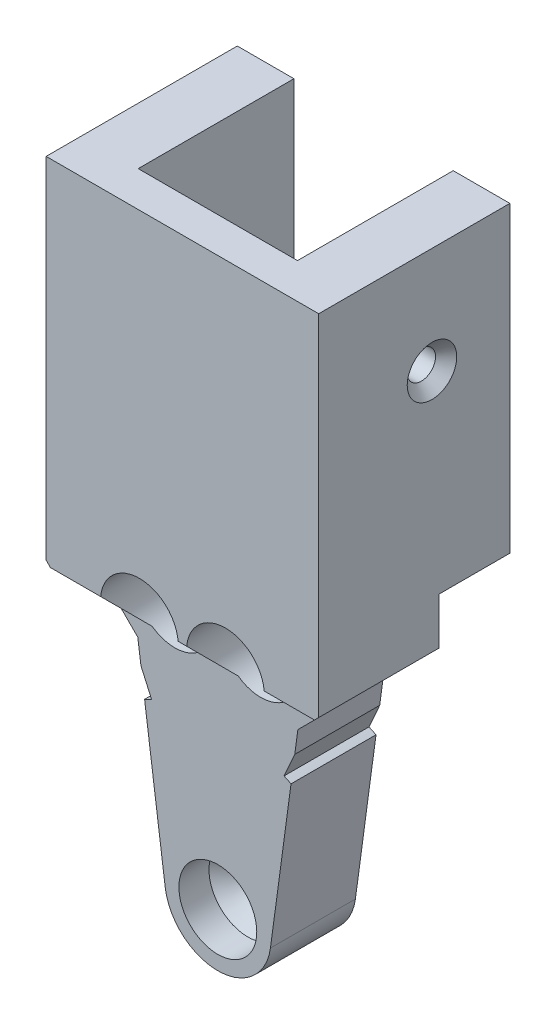
from build123d import *

# Parameters (mm, degrees)
SKETCH1_R                = 2.75
BOSS_EXTRUDE1_DEPTH      = 12
BOSS_EXTRUDE2_DEPTH      = 30
BOSS_EXTRUDE2_DEPTH_BACK = 10
CHAMFER1_SIZE            = 17.501152045
CHAMFER1_SIZE_2          = 15
SKETCH4_R                = 2
CUT_EXTRUDE1_DEPTH       = 30
CHAMFER2_SIZE            = 1.5
CUT_EXTRUDE2_DEPTH       = 30
CUT_EXTRUDE2_DEPTH_BACK  = 4
SKETCH5_R                = 5.5
CHAMFER3_SIZE            = 3
BOSS_EXTRUDE3_DEPTH      = 10


with BuildPart() as part:
    # Sketch1 → Boss-Extrude1 (new body)
    with BuildSketch(Plane.XY):
        with BuildLine():
            Line((0, 55), (-15, 55))
            Line((-15, 55), (-10.865898, 24.40520649))
            Line((-10.865898, 24.40520649), (-9.354942791, 21.011545526))
            ThreePointArc((-9.354942791, 21.011545526), (-9.852249787, 20.783002048), (-10.343977944, 20.542690191))
            Line((-10.343977944, 20.542690191), (-7.432453853, -1.004305596))
            ThreePointArc((-7.432453853, -1.004305596), (-4.935468976, -5.647224627), (0, -7.5))
            Line((0, -7.5), (0, -2.75))
            ThreePointArc((0, -2.75), (-2.75, 0), (0, 2.75))
            Line((0, 2.75), (0, 55))
        make_face()
        with Locations((-6.077686218, 34.468271355)):
            Circle(SKETCH1_R, mode=Mode.SUBTRACT)
    extrude(amount=BOSS_EXTRUDE1_DEPTH)

    # Sketch3 → Boss-Extrude2 (add, two sides: drawn at the far end of the back side and taken through both)
    with BuildSketch(Plane(origin=(0, 55, 0), x_dir=(1, 0, 0), z_dir=(0, 1, 0)).offset(-BOSS_EXTRUDE2_DEPTH_BACK)):
        Polygon((0, -17), (-19.25, -17), (-19.25, 10), (-11.25, 10), (-11.25, -12), (0, -12), align=None)
    extrude(amount=BOSS_EXTRUDE2_DEPTH + BOSS_EXTRUDE2_DEPTH_BACK)

    # Chamfer1
    # the kernel refuses this chamfer: 17.501152045, 15 mm, written as the material it adds along each edge
    with BuildSketch(Plane(origin=(-13.648756365, 45, 12), x_dir=(0.1571469904838525, -0.9875752241636421, 0), z_dir=(0, 0, -1))) as chamfer1_piece_1_section:
        Polygon((CHAMFER1_SIZE * 0.999724117502, CHAMFER1_SIZE * 0.0234880574124), (-CHAMFER1_SIZE_2 * 0.157146990484, CHAMFER1_SIZE_2 * 0.987575224164), (0, 0), align=None)
    chamfer1_piece_1 = extrude(amount=12, mode=Mode.PRIVATE)
    chamfer1_piece_1 = split(chamfer1_piece_1, bisect_by=Plane(origin=(-19.25, 37.743808278, 6), z_dir=(1, 0, 0)), keep=Keep.TOP, mode=Mode.PRIVATE)
    add(chamfer1_piece_1)
    # the kernel refuses this chamfer: 17.501152045, 15 mm, written as the material it adds along each edge
    with BuildSketch(Plane(origin=(0, 45, 12), x_dir=(0, 0.02749587661058632, 0.9996219169112968), z_dir=(-1, 0, 0))) as chamfer1_2_piece_1_section:
        Polygon((CHAMFER1_SIZE_2 * 0.999621916911, -CHAMFER1_SIZE_2 * 0.0274958766106), (-CHAMFER1_SIZE_2 * 0.0274958766106, -CHAMFER1_SIZE_2 * 0.999621916911), (0, 0), align=None)
    chamfer1_2_piece_1 = extrude(amount=19.25, mode=Mode.PRIVATE)
    chamfer1_2_piece_1 = chamfer1_2_piece_1 - Plane(origin=(-6.077686218, 34.468271355, 14.181154437), x_dir=(1, 0, 0), z_dir=(0, 0, -1)) * Cylinder(2.75, 99, mode=Mode.PRIVATE)
    chamfer1_2_piece_1 = split(chamfer1_2_piece_1, bisect_by=Plane(origin=(-16.223862411, 32.575106046, 14.181154437), z_dir=(0.7071067811865486, 0.7071067811865466, 0)), keep=Keep.TOP, mode=Mode.PRIVATE)
    chamfer1_2_piece_1 = split(chamfer1_2_piece_1, bisect_by=Plane(origin=(-9.68028065, 39.118687807, 17), z_dir=(0, 0, -1)), keep=Keep.TOP, mode=Mode.PRIVATE)
    add(chamfer1_2_piece_1)

    # Sketch4 → Cut-Extrude1 (cut)
    with BuildSketch(Plane.ZY.offset(19.25)):
        with Locations((1, 70)):
            Circle(SKETCH4_R)
    extrude(amount=-CUT_EXTRUDE1_DEPTH, mode=Mode.SUBTRACT)

    # Chamfer2
    chamfer2_edges = [part.edges().sort_by_distance(p)[0] for p in [
        (-19.25, 70, -1),
    ]]
    chamfer(chamfer2_edges, length=CHAMFER2_SIZE)

    # Sketch5 → Cut-Extrude2 (cut, two sides: drawn at the far end of the back side and taken through both)
    with BuildSketch(Plane.XY.offset(12).offset(-CUT_EXTRUDE2_DEPTH_BACK)):
        Circle(SKETCH5_R)
        with Locations(Location((-6.077686218, 34.468271355, 0), (0, 0, 180))):
            Circle(SKETCH5_R)
    extrude(amount=CUT_EXTRUDE2_DEPTH + CUT_EXTRUDE2_DEPTH_BACK, mode=Mode.SUBTRACT)

    # Chamfer3
    # the kernel refuses this chamfer: 3 mm, written as the material it takes off along each edge
    with BuildSketch(Plane(origin=(0, 0, 8), x_dir=(0.9999950652018582, -0.003141587485879657, 0), z_dir=(0.003141587485879657, 0.9999950652018582, 0))) as chamfer3_piece_1_section:
        Polygon((2.75, CHAMFER3_SIZE), (2.75 + CHAMFER3_SIZE, 0), (2.75, 0), align=None)
    chamfer3_piece_1 = revolve(axis=Axis((0, 0, 8), (0, 0, -1)), revolution_arc=359.64, mode=Mode.PRIVATE)
    chamfer3_piece_1 = chamfer3_piece_1 & Plane(origin=(0, 0, 6.366829543), x_dir=(1, 0, 0), z_dir=(0, 0, 1)) * Cylinder(5.5, 24, mode=Mode.PRIVATE)
    add(chamfer3_piece_1, mode=Mode.SUBTRACT)
    with BuildSketch(Plane(origin=(-6.077686218, 34.468271355, 8), x_dir=(1, 0, 0), z_dir=(0, 1, 0))) as chamfer3_piece_2_section:
        Polygon((2.75, CHAMFER3_SIZE), (2.75 + CHAMFER3_SIZE, 0), (2.75, 0), align=None)
    chamfer3_piece_2 = revolve(axis=Axis((-6.077686218, 34.468271355, 8), (0, 0, -1)), mode=Mode.PRIVATE)
    chamfer3_piece_2 = chamfer3_piece_2 & Plane(origin=(-6.077686218, 34.468271355, 6.366840969), x_dir=(-1, 0, 0), z_dir=(0, 0, 1)) * Cylinder(5.5, 23, mode=Mode.PRIVATE)
    add(chamfer3_piece_2, mode=Mode.SUBTRACT)

    # Sketch6 → Boss-Extrude3 (add)
    with BuildSketch(Plane(origin=(0, 0, 0), x_dir=(-1, 0, 0), z_dir=(0, 0, -1))):
        with BuildLine():
            Line((19.25, 42.201895692), (19.25, 55))
            Line((19.25, 55), (0, 55))
            Line((0, 55), (0, 46.384938288))
            ThreePointArc((0, 46.384938288), (9.849623665, 45.327115656), (19.25, 42.201895692))
        make_face()
    extrude(amount=BOSS_EXTRUDE3_DEPTH)

    # Mirror1: part across plane


with BuildPart() as part_1:
    add(part.part)
    add(part.part.mirror(Plane(origin=(0, 0, 12), x_dir=(0, 0, 1), z_dir=(-1, 0, 0))))


solid = part_1.part
